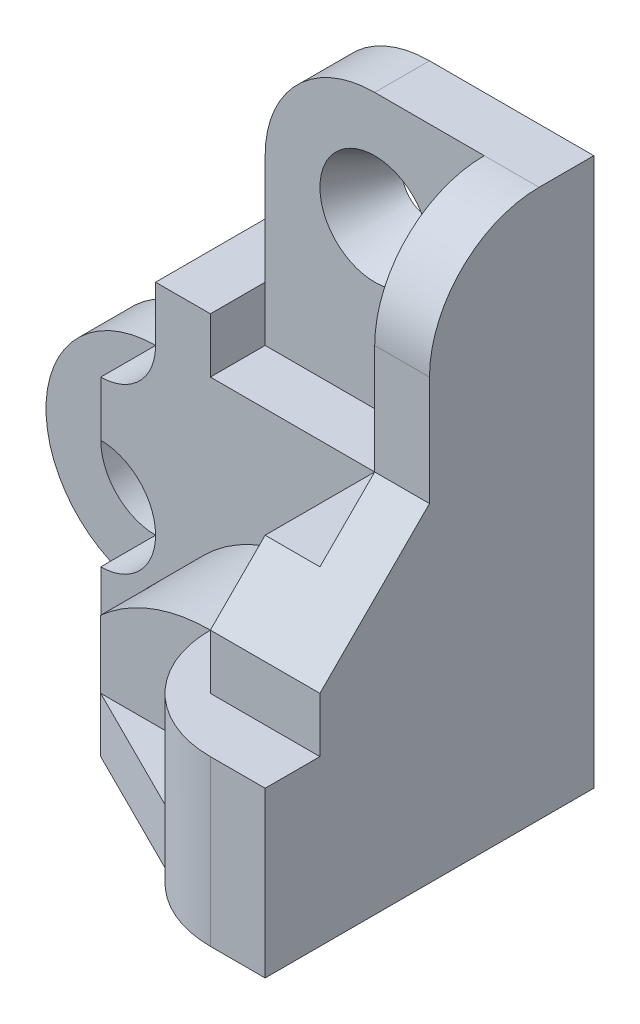
from build123d import *

# Parameters (mm, degrees)
SKETCH1_R           = 1
BOSS_EXTRUDE1_DEPTH = 2
SKETCH2_W           = 4
SKETCH2_H           = 5
SKETCH2_W_2         = 2.463434366
SKETCH2_H_2         = 4
CUT_EXTRUDE1_DEPTH  = 1
BOSS_EXTRUDE2_DEPTH = 4
CUT_EXTRUDE2_DEPTH  = 4
CUT_EXTRUDE3_DEPTH  = 2
CUT_EXTRUDE4_START  = -3
CUT_EXTRUDE4_DEPTH  = 2.234970342


with BuildPart() as part:
    # Sketch1 → Boss-Extrude1 (new body)
    with BuildSketch(Plane.XY):
        with BuildLine():
            Line((1, 5), (1, 6))
            Line((1, 6), (2, 6))
            Line((2, 6), (2, 8))
            ThreePointArc((2, 8), (2.585786438, 9.414213562), (4, 10))
            Line((4, 10), (7, 10))
            Line((7, 10), (7, 0))
            Line((7, 0), (0, 0))
            ThreePointArc((0, 0), (-2, 2), (0, 4))
            ThreePointArc((0, 4), (0.707106781, 4.292893219), (1, 5))
        make_face()
        with Locations((0, 2)):
            Circle(SKETCH1_R, mode=Mode.SUBTRACT)
    extrude(amount=BOSS_EXTRUDE1_DEPTH)

    # Sketch2 → Cut-Extrude1 (cut)
    with BuildSketch(Plane.XY.offset(2)):
        with Locations((4, 7.5)):
            Rectangle(SKETCH2_W, SKETCH2_H)
        with Locations((-1.231717183, 2)):
            Rectangle(SKETCH2_W_2, SKETCH2_H_2)
    extrude(amount=-CUT_EXTRUDE1_DEPTH, mode=Mode.SUBTRACT)

    # Sketch3 → Boss-Extrude2 (add)
    with BuildSketch(Plane.XY.offset(2)):
        with BuildLine():
            Line((7, 10), (6, 10))
            Line((6, 10), (6, 5))
            Line((6, 5), (5, 5))
            Line((5, 5), (5, 3))
            Line((5, 3), (4, 3))
            ThreePointArc((4, 3), (1.878679656, 2.121320344), (1, 0))
            Line((1, 0), (7, 0))
            Line((7, 0), (7, 10))
        make_face()
    extrude(amount=BOSS_EXTRUDE2_DEPTH)

    # Sketch4 → Cut-Extrude2 (cut)
    with BuildSketch(Plane(origin=(7, 0, 0), x_dir=(0, 0, -1), z_dir=(1, 0, 0))):
        with BuildLine():
            Line((-3, 8), (-3, 6))
            Line((-3, 6), (-5, 4))
            Line((-5, 4), (-5, 3))
            Line((-5, 3), (-6, 3))
            Line((-6, 3), (-6, 10))
            Line((-6, 10), (-1, 10))
            ThreePointArc((-1, 10), (-2.414213562, 9.414213562), (-3, 8))
        make_face()
    extrude(amount=-CUT_EXTRUDE2_DEPTH, mode=Mode.SUBTRACT)

    # Sketch5 → Cut-Extrude3 (cut)
    with BuildSketch(Plane(origin=(0, 3, 0), x_dir=(1, 0, 0), z_dir=(0, 1, 0))):
        with BuildLine():
            Line((6, -6), (1.997304718, -6))
            Line((1.997304718, -6), (1.997304718, -4))
            Line((1.997304718, -4), (4, -4))
            ThreePointArc((4, -4), (4.585786438, -5.414213562), (6, -6))
        make_face()
    extrude(amount=-CUT_EXTRUDE3_DEPTH, mode=Mode.SUBTRACT)

    # Cut-Extrude4: read off the stored shape, not the designer's step
    # Cut-Extrude4 outline → Cut-Extrude4 (cut)
    with BuildSketch(Plane(origin=(0, 3, 0), x_dir=(1, 0, 0), z_dir=(0, 1, 0)).offset(CUT_EXTRUDE4_START)):
        with BuildLine():
            Line((1.998773483, -2.995283948), (1, -2.995283948))
            Line((1, -2.995283948), (1, -6))
            Line((1, -6), (6, -6))
            ThreePointArc((6, -6), (5.106054728, -5.78909526), (4.400646751, -5.200861851))
            Line((4.400646751, -5.200861851), (1.997304718, -4))
            Line((1.997304718, -4), (1.998773483, -2.995283948))
        make_face()
    extrude(amount=CUT_EXTRUDE4_DEPTH, mode=Mode.SUBTRACT)

    # Sketch8 → Cut-Revolve1 (revolve, cut)
    with BuildSketch(Plane(origin=(4, 0, 0), x_dir=(0, 0, -1), z_dir=(1, 0, 0)), mode=Mode.PRIVATE) as cut_revolve1_sk:
        Polygon((0, 8), (0, 8.5), (-1, 9), (-1, 8), align=None)
    revolve(cut_revolve1_sk.sketch.rotate(Axis((4, 8, -0.711012061), (0, 0, 1)), 90), axis=Axis((4, 8, -0.711012061), (0, 0, 1)), mode=Mode.SUBTRACT)


solid = part.part
